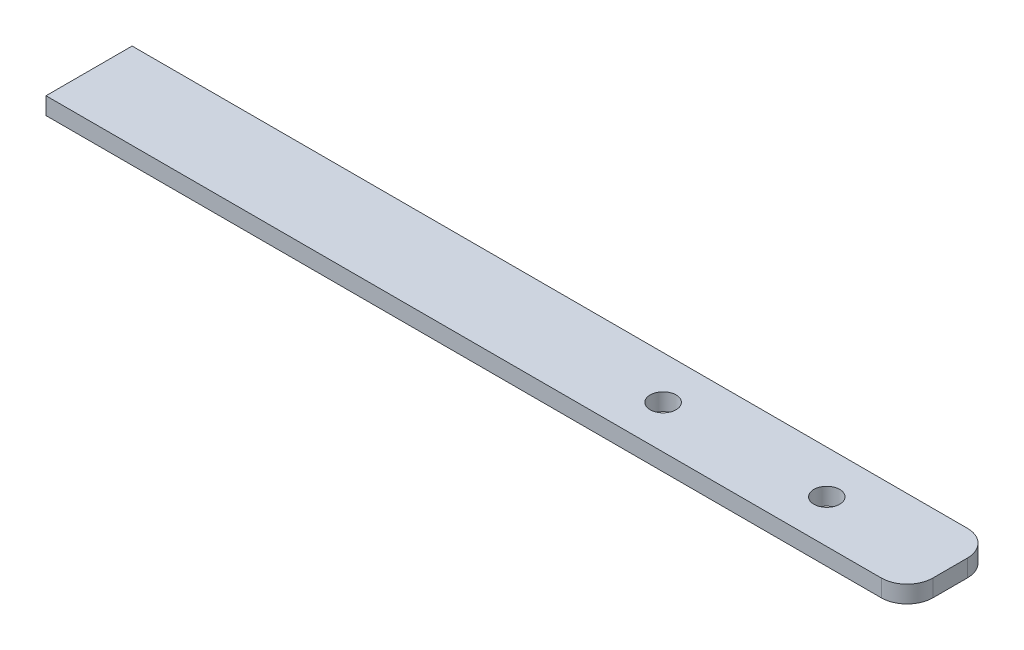
from build123d import *

# Parameters (mm, degrees)
SKETCH1_W             = 100
SKETCH1_H             = 10
BOSS_EXTRUDE1_DEPTH   = 2
FILLET1_R             = 3
F_3_0MM_DOWEL_HOLE1_D = 3


with BuildPart() as part:
    # Sketch1 → Boss-Extrude1 (new body)
    with BuildSketch(Plane(origin=(0, 0, 0), x_dir=(1, 0, 0), z_dir=(0, 1, 0))):
        Rectangle(SKETCH1_W, SKETCH1_H)
    extrude(amount=BOSS_EXTRUDE1_DEPTH)

    # Fillet1
    fillet1_edges = [part.edges().sort_by_distance(p)[0] for p in [
        (50, 1, 5),
        (50, 1, -5),
    ]]
    fillet(fillet1_edges, radius=FILLET1_R)

    # Ø3.0mm Dowel Hole1 (through all)
    with Locations(Plane(origin=(0, 2, 0), x_dir=(1, 0, 0), z_dir=(0, 1, 0))):
        with Locations((35.674467955, 0), (16.669467955, 0)):
            Hole(F_3_0MM_DOWEL_HOLE1_D / 2)


solid = part.part
